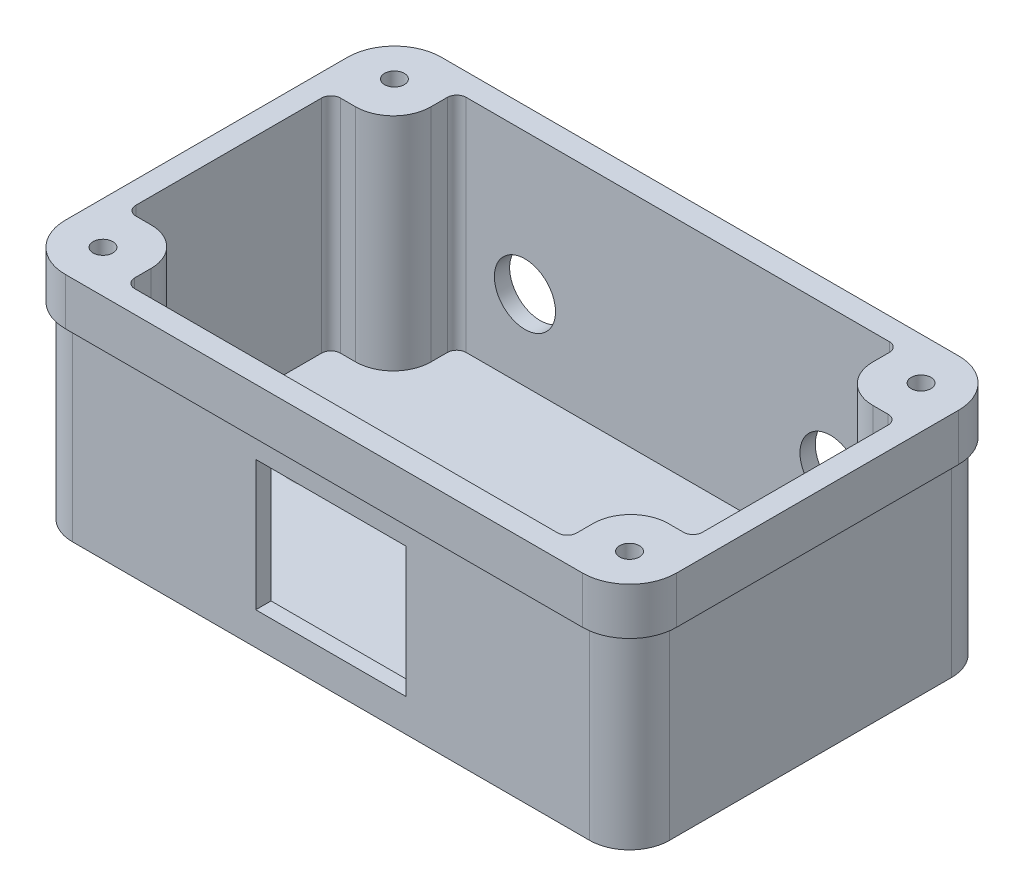
from build123d import *

# Parameters (mm, degrees)
BOSS_EXTRUDE1_DEPTH = 50
SHELL1_T            = -3
CUT_EXTRUDE1_DEPTH  = 40
SKETCH3_R           = 2.1
BOSS_EXTRUDE5_DEPTH = 47
SKETCH5_R           = 2
CUT_EXTRUDE2_DEPTH  = 10
BOSS_EXTRUDE6_START = 3
SKETCH6_R           = 6
SKETCH6_R_2         = 2
BOSS_EXTRUDE6_DEPTH = 3
FILLET1_R           = 1
SKETCH7_W           = 32
SKETCH7_H           = 27.7
CUT_EXTRUDE3_DEPTH  = 10
SKETCH8_R           = 6.5
CUT_EXTRUDE4_DEPTH  = 10


with BuildPart() as part:
    # Sketch1 → Boss-Extrude1 (new body)
    with BuildSketch(Plane(origin=(0, 0, 0), x_dir=(1, 0, 0), z_dir=(0, 1, 0))):
        with BuildLine():
            Line((-55, 40), (55, 40))
            ThreePointArc((55, 40), (62.071067812, 37.071067812), (65, 30))
            Line((65, 30), (65, -30))
            ThreePointArc((65, -30), (62.071067812, -37.071067812), (55, -40))
            Line((55, -40), (-55, -40))
            ThreePointArc((-55, -40), (-62.071067812, -37.071067812), (-65, -30))
            Line((-65, -30), (-65, 30))
            ThreePointArc((-65, 30), (-62.071067812, 37.071067812), (-55, 40))
        make_face()
    extrude(amount=BOSS_EXTRUDE1_DEPTH)

    # Shell1
    shell1_openings = [part.faces().sort_by_distance(p)[0] for p in [
        (0, 50, 0),
    ]]
    offset(amount=SHELL1_T, openings=shell1_openings, kind=Kind.INTERSECTION)

    # Sketch2 → Cut-Extrude1 (cut)
    with BuildSketch(Plane.XZ):
        with BuildLine():
            Line((65, -30), (65, 30))
            ThreePointArc((65, 30), (62.071067812, 37.071067812), (55, 40))
            Line((55, 40), (-55, 40))
            ThreePointArc((-55, 40), (-62.071067812, 37.071067812), (-65, 30))
            Line((-65, 30), (-65, -30))
            ThreePointArc((-65, -30), (-62.071067812, -37.071067812), (-55, -40))
            Line((-55, -40), (55, -40))
            ThreePointArc((55, -40), (62.071067812, -37.071067812), (65, -30))
        make_face()
        with BuildLine():
            Line((-63.5, 30), (-63.5, -30))
            ThreePointArc((-63.5, -30), (-61.01040764, -36.01040764), (-55, -38.5))
            Line((-55, -38.5), (55, -38.5))
            ThreePointArc((55, -38.5), (61.01040764, -36.01040764), (63.5, -30))
            Line((63.5, -30), (63.5, 30))
            ThreePointArc((63.5, 30), (61.01040764, 36.01040764), (55, 38.5))
            Line((55, 38.5), (-55, 38.5))
            ThreePointArc((-55, 38.5), (-61.01040764, 36.01040764), (-63.5, 30))
        make_face(mode=Mode.SUBTRACT)
    extrude(amount=-CUT_EXTRUDE1_DEPTH, mode=Mode.SUBTRACT)

    # Sketch5 → Cut-Extrude2 (cut)
    with BuildSketch(Plane(origin=(0, 3, 0), x_dir=(1, 0, 0), z_dir=(0, 1, 0))):
        with Locations((-40, 0)):
            Circle(SKETCH5_R)
        with Locations((40, 0)):
            Circle(SKETCH5_R)
    extrude(amount=-CUT_EXTRUDE2_DEPTH, mode=Mode.SUBTRACT)


with BuildPart() as body_2:
    # Sketch3 → Boss-Extrude5 (new body)
    with BuildSketch(Plane(origin=(0, 3, 0), x_dir=(1, 0, 0), z_dir=(0, 1, 0))):
        with BuildLine():
            Line((62, -30), (62, 30))
            ThreePointArc((62, 30), (59.949747468, 34.949747468), (55, 37))
            Line((55, 37), (-55, 37))
            ThreePointArc((-55, 37), (-59.949747468, 34.949747468), (-62, 30))
            Line((-62, 30), (-62, -30))
            ThreePointArc((-62, -30), (-59.949747468, -34.949747468), (-55, -37))
            Line((-55, -37), (55, -37))
            ThreePointArc((55, -37), (59.949747468, -34.949747468), (62, -30))
        make_face()
        with Locations((-56, 31)):
            Circle(SKETCH3_R, mode=Mode.SUBTRACT)
        with Locations((56, 31)):
            Circle(SKETCH3_R, mode=Mode.SUBTRACT)
        with Locations((56, -31)):
            Circle(SKETCH3_R, mode=Mode.SUBTRACT)
        with Locations((-56, -31)):
            Circle(SKETCH3_R, mode=Mode.SUBTRACT)
        with BuildLine():
            Line((-58.25, 21.75), (-55, 21.75))
            ThreePointArc((-55, 21.75), (-49.343145751, 24.093145751), (-47, 29.75))
            Line((-47, 29.75), (-47, 33.25))
            ThreePointArc((-47, 33.25), (-46.414213562, 34.664213562), (-45, 35.25))
            Line((-45, 35.25), (45, 35.25))
            ThreePointArc((45, 35.25), (46.414213562, 34.664213562), (47, 33.25))
            Line((47, 33.25), (47, 29.75))
            ThreePointArc((47, 29.75), (49.343145751, 24.093145751), (55, 21.75))
            Line((55, 21.75), (58.25, 21.75))
            ThreePointArc((58.25, 21.75), (59.664213562, 21.164213562), (60.25, 19.75))
            Line((60.25, 19.75), (60.25, -19.75))
            ThreePointArc((60.25, -19.75), (59.664213562, -21.164213562), (58.25, -21.75))
            Line((58.25, -21.75), (55, -21.75))
            ThreePointArc((55, -21.75), (49.343145751, -24.093145751), (47, -29.75))
            Line((47, -29.75), (47, -33.25))
            ThreePointArc((47, -33.25), (46.414213562, -34.664213562), (45, -35.25))
            Line((45, -35.25), (-45, -35.25))
            ThreePointArc((-45, -35.25), (-46.414213562, -34.664213562), (-47, -33.25))
            Line((-47, -33.25), (-47, -29.75))
            ThreePointArc((-47, -29.75), (-49.343145751, -24.093145751), (-55, -21.75))
            Line((-55, -21.75), (-58.25, -21.75))
            ThreePointArc((-58.25, -21.75), (-59.664213562, -21.164213562), (-60.25, -19.75))
            Line((-60.25, -19.75), (-60.25, 19.75))
            ThreePointArc((-60.25, 19.75), (-59.664213562, 21.164213562), (-58.25, 21.75))
        make_face(mode=Mode.SUBTRACT)
    extrude(amount=BOSS_EXTRUDE5_DEPTH)


    add(part.part)  # Boss-Extrude6 merges part
    # Sketch6 → Boss-Extrude6 (add)
    # profile 1 of 2: a face of its own
    with BuildSketch(Plane(origin=(0, 3, 0), x_dir=(1, 0, 0), z_dir=(0, 1, 0)).offset(BOSS_EXTRUDE6_START)):
        with Locations((-40, 0)):
            Circle(SKETCH6_R)
        with Locations((-40, 0)):
            Circle(SKETCH6_R_2, mode=Mode.SUBTRACT)
    # profile 2 of 2: a face of its own
    with BuildSketch(Plane(origin=(0, 3, 0), x_dir=(1, 0, 0), z_dir=(0, 1, 0)).offset(BOSS_EXTRUDE6_START)):
        with Locations((40, 0)):
            Circle(SKETCH6_R)
        with Locations((40, 0)):
            Circle(SKETCH6_R_2, mode=Mode.SUBTRACT)
    extrude(amount=-BOSS_EXTRUDE6_DEPTH)

    # Fillet1
    fillet1_edges = [body_2.edges().sort_by_distance(p)[0] for p in [
        (34, 6, 0),
        (34, 3, 0),
        (-46, 6, 0),
        (-46, 3, 0),
    ]]
    fillet(fillet1_edges, radius=FILLET1_R)

    # Sketch7 → Cut-Extrude3 (cut)
    with BuildSketch(Plane.XY.offset(38.5)):
        with Locations((0, 20.830272727)):
            Rectangle(SKETCH7_W, SKETCH7_H)
    extrude(amount=-CUT_EXTRUDE3_DEPTH, mode=Mode.SUBTRACT)

    # Sketch8 → Cut-Extrude4 (cut)
    with BuildSketch(Plane(origin=(0, 0, -38.5), x_dir=(-1, 0, 0), z_dir=(0, 0, -1))):
        with Locations((-32.5, 20)):
            Circle(SKETCH8_R)
        with Locations((32.5, 20)):
            Circle(SKETCH8_R)
    extrude(amount=-CUT_EXTRUDE4_DEPTH, mode=Mode.SUBTRACT)


solid = body_2.part
